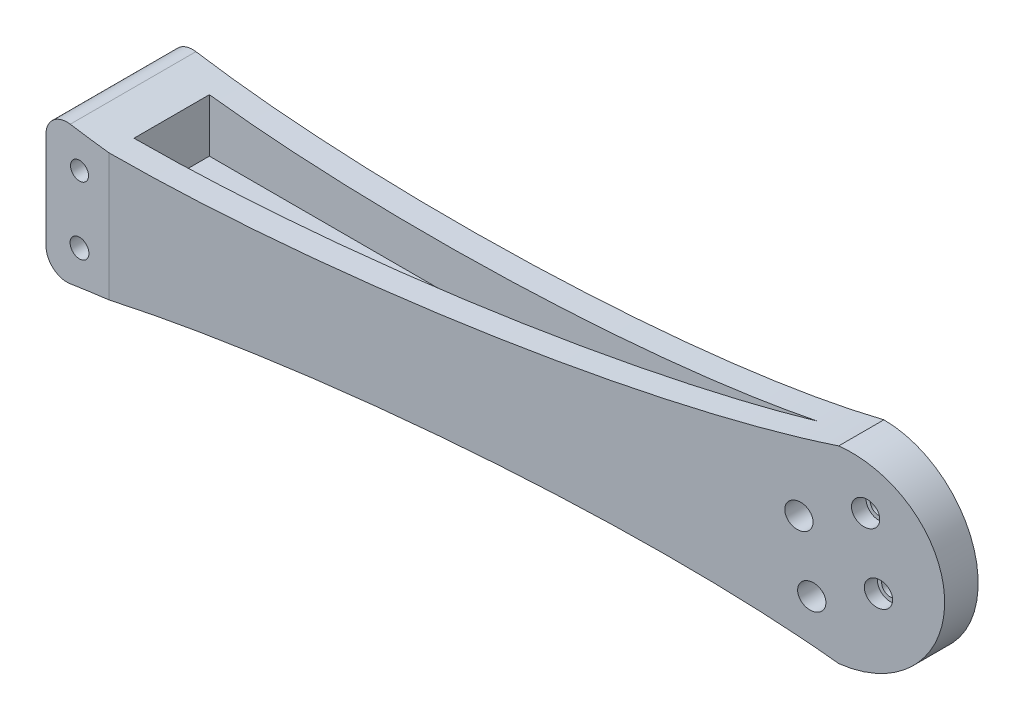
from build123d import *

# Parameters (mm, degrees)
SKETCH1_R                                        = 2
BOSS_EXTRUDE1_DEPTH                              = 15
CUT_EXTRUDE7_START                               = 15
SKETCH1_3_R                                      = 5
CUT_EXTRUDE7_DEPTH                               = 4
CUT_EXTRUDE2_START                               = -22.5000001
CUT_EXTRUDE2_DEPTH                               = 45.0000001
CUT_EXTRUDE6_DEPTH                               = 30
CBORE_FOR_M3_HEX_HEAD_MACHINE_SCREW3_D           = 3
CBORE_FOR_M3_HEX_HEAD_MACHINE_SCREW3_DEPTH       = 25
CBORE_FOR_M3_HEX_HEAD_MACHINE_SCREW3_CBORE_D     = 6
CBORE_FOR_M3_HEX_HEAD_MACHINE_SCREW3_CBORE_DEPTH = 18
CBORE_FOR_M3_HEX_HEAD_MACHINE_SCREW3_TIP         = 0.901290929
CUT_EXTRUDE4_START                               = 15
SKETCH19_R                                       = 2.15
SKETCH19_R_2                                     = 2.25
CUT_EXTRUDE4_DEPTH                               = 10
CUT_EXTRUDE5_START                               = -5
SKETCH19_2_R                                     = 2.15
SKETCH19_2_R_2                                   = 2.25
CUT_EXTRUDE5_DEPTH                               = 10
BOSS_EXTRUDE3_DEPTH                              = 2.5
CBORE_FOR_M3_SHCS2_D                             = 3
CBORE_FOR_M3_SHCS2_DEPTH                         = 12
CBORE_FOR_M3_SHCS2_CBORE_D                       = 4.3
CBORE_FOR_M3_SHCS2_CBORE_DEPTH                   = 5.2
CBORE_FOR_M3_SHCS3_D                             = 2.5
CBORE_FOR_M3_SHCS3_DEPTH                         = 12
CBORE_FOR_M3_SHCS3_CBORE_D                       = 4.3
CBORE_FOR_M3_SHCS3_CBORE_DEPTH                   = 5.2
FILLET2_R                                        = 5
CUT_EXTRUDE9_START                               = -15
SKETCH1_5_R                                      = 5
CUT_EXTRUDE9_DEPTH                               = 3


# Read off the part's stored shape, not the designer's step: Cut-Extrude2
with BuildPart() as part:
    # Sketch1 → Boss-Extrude1 (new, symmetric)
    with BuildSketch(Plane.XY):
        with BuildLine():
            Line((0, 17.5), (0, -17.5))
            add(Edge.make_bspline(
                [(0, -17.5), (43.884108447, -9.177006937), (123.842028205, -11.029704256), (170, -22.5)],
                knots=[0, 0, 0, 0, 1, 1, 1, 1], degree=3))
            ThreePointArc((170, -22.5), (192.5, 0), (170, 22.5))
            add(Edge.make_bspline(
                [(170, 22.5), (123.842028205, 11.029704256), (43.884108447, 9.177006937), (0, 17.5)],
                knots=[0.933681919, 0.933681919, 0.933681919, 0.933681919, 1.933681919, 1.933681919, 1.933681919, 1.933681919], degree=3))
        make_face()
        with Locations((175.71763899, 11.115691808)):
            Circle(SKETCH1_R, mode=Mode.SUBTRACT)
        with Locations((164.28236101, -11.115691808)):
            Circle(SKETCH1_R, mode=Mode.SUBTRACT)
        with Locations((178.447925774, -4.345405633)):
            Circle(SKETCH1_R, mode=Mode.SUBTRACT)
        with Locations((161.552074226, 4.345405633)):
            Circle(SKETCH1_R, mode=Mode.SUBTRACT)
    extrude(amount=BOSS_EXTRUDE1_DEPTH, both=True)

    # Sketch1<3> → Cut-Extrude7 (cut)
    with BuildSketch(Plane.XY.offset(CUT_EXTRUDE7_START)):
        with Locations((170, 0)):
            Circle(SKETCH1_3_R)
    extrude(amount=-CUT_EXTRUDE7_DEPTH, mode=Mode.SUBTRACT)

    # Cut-Extrude2 outline → Cut-Extrude2 (cut)
    with BuildSketch(Plane(origin=(0, 0, 0), x_dir=(1, 0, 0), z_dir=(0, 1, 0)).offset(CUT_EXTRUDE2_START)):
        Polygon((14.999999991, -15.000000001), (194, -15), (194, 7.185915493), (192.500000099, 7.000000012), align=None)
    extrude(amount=CUT_EXTRUDE2_DEPTH, mode=Mode.SUBTRACT)

    # Sketch20 → Cut-Extrude6 (cut, symmetric)
    with BuildSketch(Plane(origin=(0, 0, 0), x_dir=(1, 0, 0), z_dir=(0, 1, 0))):
        Polygon((15, -9), (15, 9), (160, 9), (160, 8.971830985), align=None)
    extrude(amount=CUT_EXTRUDE6_DEPTH, both=True, mode=Mode.SUBTRACT)

    # CBORE for M3 Hex Head Machine Screw3
    with Locations(Plane(origin=(0, 0, 10), x_dir=(-1, 0, 0), z_dir=(0, 0, 1))):
        with Locations((-175.71763899, -11.115691808), (-161.552074226, -4.345405633), (-164.28236101, 11.115691808), (-178.447925774, 4.345405633)):
            CounterBoreHole(CBORE_FOR_M3_HEX_HEAD_MACHINE_SCREW3_D / 2, CBORE_FOR_M3_HEX_HEAD_MACHINE_SCREW3_CBORE_D / 2, CBORE_FOR_M3_HEX_HEAD_MACHINE_SCREW3_CBORE_DEPTH, depth=CBORE_FOR_M3_HEX_HEAD_MACHINE_SCREW3_DEPTH)
            with Locations((0, 0, -(CBORE_FOR_M3_HEX_HEAD_MACHINE_SCREW3_DEPTH + CBORE_FOR_M3_HEX_HEAD_MACHINE_SCREW3_TIP / 2))):  # 118° drill point
                Cone(0, CBORE_FOR_M3_HEX_HEAD_MACHINE_SCREW3_D / 2, CBORE_FOR_M3_HEX_HEAD_MACHINE_SCREW3_TIP, mode=Mode.SUBTRACT)

    # Sketch19 → Cut-Extrude4 (cut)
    with BuildSketch(Plane.XY.offset(CUT_EXTRUDE4_START)):
        with Locations((8, 8)):
            Circle(SKETCH19_R)
        with Locations((8, -8)):
            Circle(SKETCH19_R_2)
    extrude(amount=-CUT_EXTRUDE4_DEPTH, mode=Mode.SUBTRACT)

    # Sketch19<2> → Cut-Extrude5 (cut)
    with BuildSketch(Plane.XY.offset(CUT_EXTRUDE5_START)):
        with Locations((8, 8)):
            Circle(SKETCH19_2_R)
        with Locations((8, -8)):
            Circle(SKETCH19_2_R_2)
    extrude(amount=-CUT_EXTRUDE5_DEPTH, mode=Mode.SUBTRACT)

    # Sketch20<3> → Boss-Extrude3 (add, symmetric)
    with BuildSketch(Plane(origin=(0, 0, 0), x_dir=(1, 0, 0), z_dir=(0, 1, 0))):
        Polygon((15, -9), (15, 9), (160, 9), (160, 8.971830985), align=None)
    extrude(amount=BOSS_EXTRUDE3_DEPTH, both=True)

    # CBORE for M3 SHCS2
    with Locations(Plane.XY.offset(15)):
        with Locations((8, 8), (8, -8)):
            CounterBoreHole(CBORE_FOR_M3_SHCS2_D / 2, CBORE_FOR_M3_SHCS2_CBORE_D / 2, CBORE_FOR_M3_SHCS2_CBORE_DEPTH, depth=CBORE_FOR_M3_SHCS2_DEPTH)

    # CBORE for M3 SHCS3
    with Locations(Plane(origin=(0, 0, -15), x_dir=(-1, 0, 0), z_dir=(0, 0, -1))):
        with Locations((-8, 8), (-8, -8)):
            CounterBoreHole(CBORE_FOR_M3_SHCS3_D / 2, CBORE_FOR_M3_SHCS3_CBORE_D / 2, CBORE_FOR_M3_SHCS3_CBORE_DEPTH, depth=CBORE_FOR_M3_SHCS3_DEPTH)

    # Fillet2
    fillet2_edges = [part.edges().sort_by_distance(p)[0] for p in [
        (0, 17.5, -7.5),
        (0, -17.5, 7.5),
    ]]
    fillet(fillet2_edges, radius=FILLET2_R)

    # Sketch1<5> → Cut-Extrude9 (cut)
    with BuildSketch(Plane.XY.offset(CUT_EXTRUDE9_START)):
        with Locations((170, 0)):
            Circle(SKETCH1_5_R)
    extrude(amount=CUT_EXTRUDE9_DEPTH, mode=Mode.SUBTRACT)


solid = part.part
